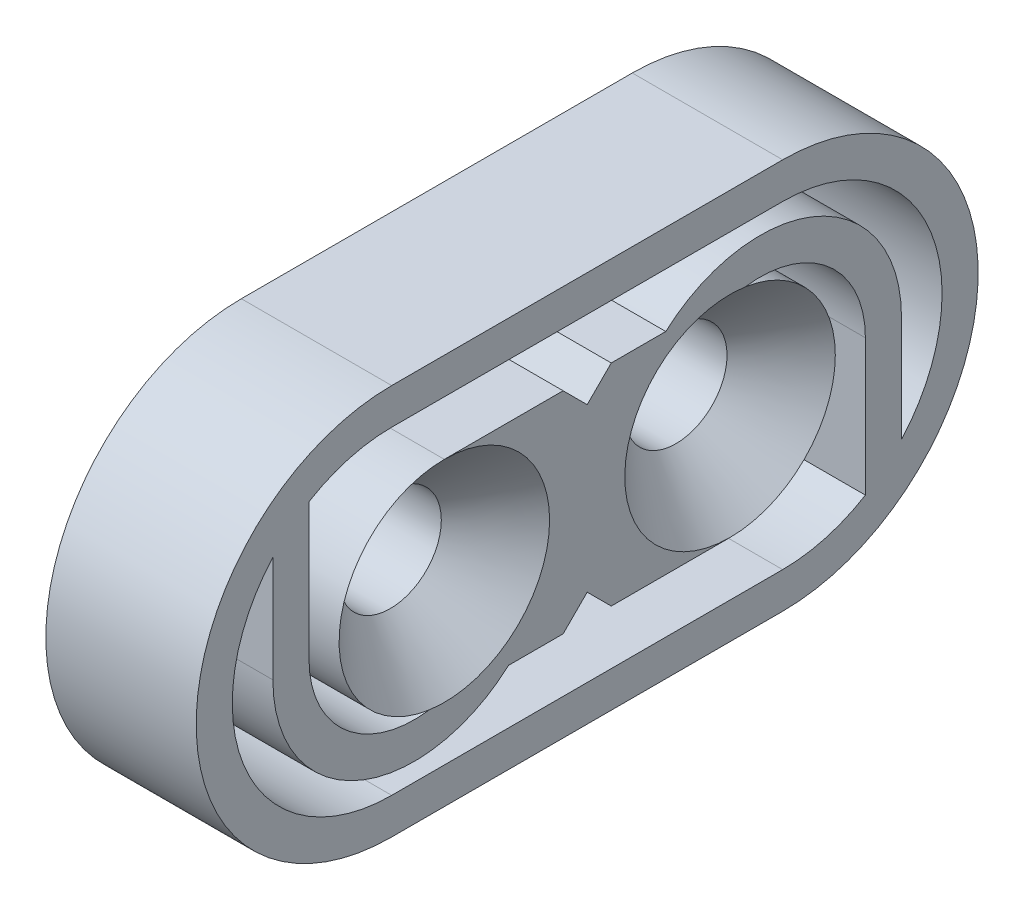
from build123d import *

# Parameters (mm, degrees)
SKETCH2_R           = 1.7
BOSS_EXTRUDE2_DEPTH = 5
CHAMFER1_SIZE       = 1.8


with BuildPart() as part:
    # Sketch2 → Boss-Extrude2 (new body)
    with BuildSketch(Plane.YZ):
        with BuildLine():
            Line((-6.472145094, 6.496243265), (-6.472145094, -6.503756735))
            ThreePointArc((-6.472145094, -6.503756735), (0.027854906, -13.003756735), (6.527854906, -6.503756735))
            Line((6.527854906, -6.503756735), (6.527854906, 6.496243265))
            ThreePointArc((6.527854906, 6.496243265), (0.027854906, 12.996243265), (-6.472145094, 6.496243265))
        make_face()
        with Locations(Location((0.027854906, 4.746243265, 0), (0, 0, 270))):
            Circle(SKETCH2_R, mode=Mode.SUBTRACT)
        with Locations(Location((0.027854906, -4.753756735, 0), (0, 0, 270))):
            Circle(SKETCH2_R, mode=Mode.SUBTRACT)
        with BuildLine():
            Line((-5.272145094, 6.496243265), (-5.272145094, -6.503756735))
            ThreePointArc((-5.272145094, -6.503756735), (-5.076205272, -7.931541625), (-4.502873512, -9.253756735))
            Line((-4.502873512, -9.253756735), (0.027854906, -9.253756735))
            ThreePointArc((0.027854906, -9.253756735), (2.673606218, -8.045044583), (3.491956522, -5.253756735))
            ThreePointArc((3.491956522, -5.253756735), (-0.222788612, -8.244770603), (-3.472145094, -4.753756735))
            Line((-3.472145094, -4.753756735), (-3.472145094, -0.803756735))
            Line((-3.472145094, -0.803756735), (-2.672145094, -0.003756735))
            Line((-2.672145094, -0.003756735), (-3.472145094, 0.796243265))
            Line((-3.472145094, 0.796243265), (-3.472145094, 2.609365837))
            ThreePointArc((-3.472145094, 2.609365837), (-4.263608941, 7.662838695), (0.027854906, 10.446243265))
            Line((0.027854906, 10.446243265), (3.561620603, 10.446243265))
            ThreePointArc((3.561620603, 10.446243265), (-2.135596249, 11.334577596), (-5.272145094, 6.496243265))
        make_face(mode=Mode.SUBTRACT)
        with BuildLine():
            Line((4.558583325, 9.246243265), (0.027854906, 9.246243265))
            ThreePointArc((0.027854906, 9.246243265), (-2.617896405, 8.037531112), (-3.436246709, 5.246243265))
            ThreePointArc((-3.436246709, 5.246243265), (0.278498425, 8.237257133), (3.527854906, 4.746243265))
            Line((3.527854906, 4.746243265), (3.527854906, 0.796243265))
            Line((3.527854906, 0.796243265), (2.727854906, -0.003756735))
            Line((2.727854906, -0.003756735), (3.527854906, -0.803756735))
            Line((3.527854906, -0.803756735), (3.527854906, -2.616879307))
            ThreePointArc((3.527854906, -2.616879307), (4.319318754, -7.670352166), (0.027854906, -10.453756735))
            Line((0.027854906, -10.453756735), (-3.50591079, -10.453756735))
            ThreePointArc((-3.50591079, -10.453756735), (2.191306062, -11.342091066), (5.327854906, -6.503756735))
            Line((5.327854906, -6.503756735), (5.327854906, 6.496243265))
            ThreePointArc((5.327854906, 6.496243265), (5.131915085, 7.924028155), (4.558583325, 9.246243265))
        make_face(mode=Mode.SUBTRACT)
    extrude(amount=BOSS_EXTRUDE2_DEPTH)

    # Chamfer1
    chamfer1_edges = [part.edges().sort_by_distance(p)[0] for p in [
        (5, 0.027854906, 6.446243265),
        (5, 0.027854906, -3.053756735),
    ]]
    chamfer(chamfer1_edges, length=CHAMFER1_SIZE - 0.0001)  # a hair under: the kernel refuses the full size


solid = part.part
